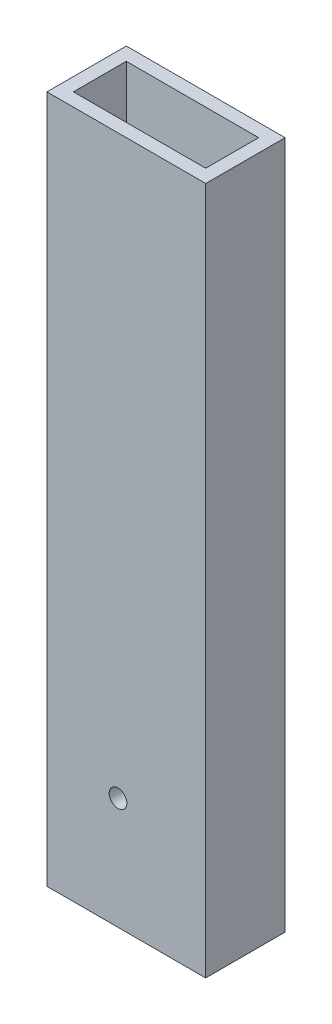
from build123d import *

# Parameters (mm, degrees)
SKETCH1_W           = 38.1
SKETCH1_H           = 19.05
SKETCH1_W_2         = 31.75
SKETCH1_H_2         = 12.7
BOSS_EXTRUDE1_DEPTH = 165.1
SKETCH2_R           = 2.125
CUT_EXTRUDE1_DEPTH  = 171.506664093


with BuildPart() as part:
    # Sketch1 → Boss-Extrude1 (new body)
    with BuildSketch(Plane(origin=(0, 0, 0), x_dir=(1, 0, 0), z_dir=(0, 1, 0))):
        with Locations((19.05, 9.525)):
            Rectangle(SKETCH1_W, SKETCH1_H)
        with Locations((19.05, 9.525)):
            Rectangle(SKETCH1_W_2, SKETCH1_H_2, mode=Mode.SUBTRACT)
    extrude(amount=BOSS_EXTRUDE1_DEPTH)

    # Sketch2 → Cut-Extrude1 (cut, through all)
    with BuildSketch(Plane(origin=(0, 0, -19.05), x_dir=(-1, 0, 0), z_dir=(0, 0, -1))):
        with Locations((-17.062243871, 26.832679639)):
            Circle(SKETCH2_R)
    extrude(amount=-CUT_EXTRUDE1_DEPTH, mode=Mode.SUBTRACT)


solid = part.part
